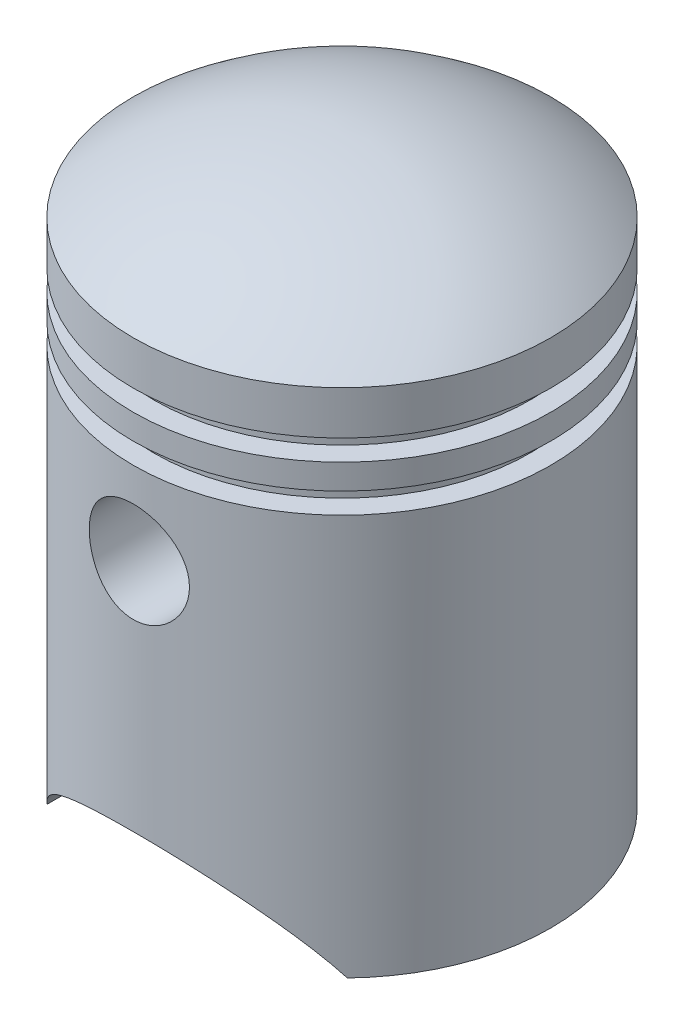
from build123d import *

# Parameters (mm, degrees)
SKETCH2_W                = 2.5
SKETCH2_H                = 2.5
LPATTERN2_COUNT          = 2
LPATTERN2_PITCH          = 5.5
CUT_EXTRUDE1_DEPTH       = 79.421935707
CUT_EXTRUDE1_DEPTH_BACK  = 79.421935707
CUT_EXTRUDE2_DEPTH       = 79.421935771
CUT_EXTRUDE2_DEPTH_BACK  = 79.421935771
SKETCH4_R                = 6
BOSS_EXTRUDE4_REACH      = 90.422
BOSS_EXTRUDE4_END_RADIUS = 23
BOSS_EXTRUDE4_START      = 10
SKETCH5_R                = 7.5
SKETCH5_R_2              = 6


# Read off the part's stored shape, not the designer's step: Shell1
with BuildPart() as part:
    # Sketch1 → Revolve1 (revolve)
    with BuildSketch(Plane.XY):
        with BuildLine():
            Line((0, 0), (0, 70))
            ThreePointArc((0, 70), (13.247648854, 67.742546282), (25, 61.224989992))
            Line((25, 61.224989992), (25, 0))
            Line((25, 0), (0, 0))
        make_face()
    revolve(axis=Axis((0, 0, 0), (0, 1, 0)))

    # Sketch2 → Cut-Revolve2 (revolve, cut)
    with BuildSketch(Plane.XY, mode=Mode.PRIVATE) as cut_revolve2_sk:
        with Locations((23.75, 49.25)):
            Rectangle(SKETCH2_W, SKETCH2_H)
    cut_revolve2 = revolve(cut_revolve2_sk.sketch.rotate(Axis((0, 79.863110142, 0), (0, 1, 0)), 90), axis=Axis((0, 79.863110142, 0), (0, 1, 0)), mode=Mode.SUBTRACT)

    # LPattern2: Cut-Revolve2 ×2
    with Locations(*[(0, i * LPATTERN2_PITCH, 0) for i in range(1, LPATTERN2_COUNT)]):
        add(cut_revolve2, mode=Mode.SUBTRACT)

    # Shell1 outline → Shell1 (revolve, cut)
    with BuildSketch(Plane.XY):
        with BuildLine():
            Line((0, 0), (23, 0))
            Line((23, 0), (23, 46))
            Line((23, 46), (20.5, 46))
            Line((20.5, 46), (20.5, 58))
            Line((20.5, 58), (23, 58))
            Line((23, 58), (23.00000001, 60.248966917))
            ThreePointArc((23.00000001, 60.248966917), (12.135469854, 66.010142619), (0, 68))
            Line((0, 68), (0, 0))
        make_face()
    revolve(axis=Axis((0, 0, 0), (0, 1, 0)), mode=Mode.SUBTRACT)

    # Sketch3 → Cut-Extrude1 (cut, two sides: drawn at the far end of the back side and taken through both)
    with BuildSketch(Plane.XY.offset(-CUT_EXTRUDE1_DEPTH_BACK)):
        with BuildLine():
            Line((-110.085446515, -147.994467613), (-18, 0))
            ThreePointArc((-18, 0), (0, 10), (18, 0))
            Line((18, 0), (110.085446515, -147.994467613))
            Line((110.085446515, -147.994467613), (110.085446515, -496.603657989))
            Line((110.085446515, -496.603657989), (-110.085446515, -496.603657989))
            Line((-110.085446515, -496.603657989), (-110.085446515, -147.994467613))
        make_face()
    extrude(amount=CUT_EXTRUDE1_DEPTH + CUT_EXTRUDE1_DEPTH_BACK, mode=Mode.SUBTRACT)

    # Sketch4 → Cut-Extrude2 (cut, two sides: drawn at the far end of the back side and taken through both)
    with BuildSketch(Plane.XY.offset(-CUT_EXTRUDE2_DEPTH_BACK)):
        with Locations((0, 38)):
            Circle(SKETCH4_R)
    extrude(amount=CUT_EXTRUDE2_DEPTH + CUT_EXTRUDE2_DEPTH_BACK, mode=Mode.SUBTRACT)

    # Boss-Extrude4: up to this cylinder (the profile starts inside it)
    boss_extrude4_end = Plane(origin=(0, 38, 0), z_dir=(0, -1, 0)) * Cylinder(BOSS_EXTRUDE4_END_RADIUS, 227.844, mode=Mode.PRIVATE)
    # Sketch5 → Boss-Extrude4 (add, up to the surface)
    with BuildSketch(Plane.XY.offset(BOSS_EXTRUDE4_START), mode=Mode.PRIVATE) as boss_extrude4_sk1:
        with Locations(Location((0, 38, 0), (0, 0, 180))):
            Circle(SKETCH5_R)
        with Locations((0, 38)):
            Circle(SKETCH5_R_2, mode=Mode.SUBTRACT)
    boss_extrude4_tool1 = extrude(boss_extrude4_sk1.sketch, amount=BOSS_EXTRUDE4_REACH, mode=Mode.PRIVATE) & boss_extrude4_end
    boss_extrude4 = boss_extrude4_tool1.solids().sort_by_distance((7.287868, 38, 10))[0]
    add(boss_extrude4)

    # Mirror1: Boss-Extrude4 across plane
    add(boss_extrude4.mirror(Plane.XY))


solid = part.part
